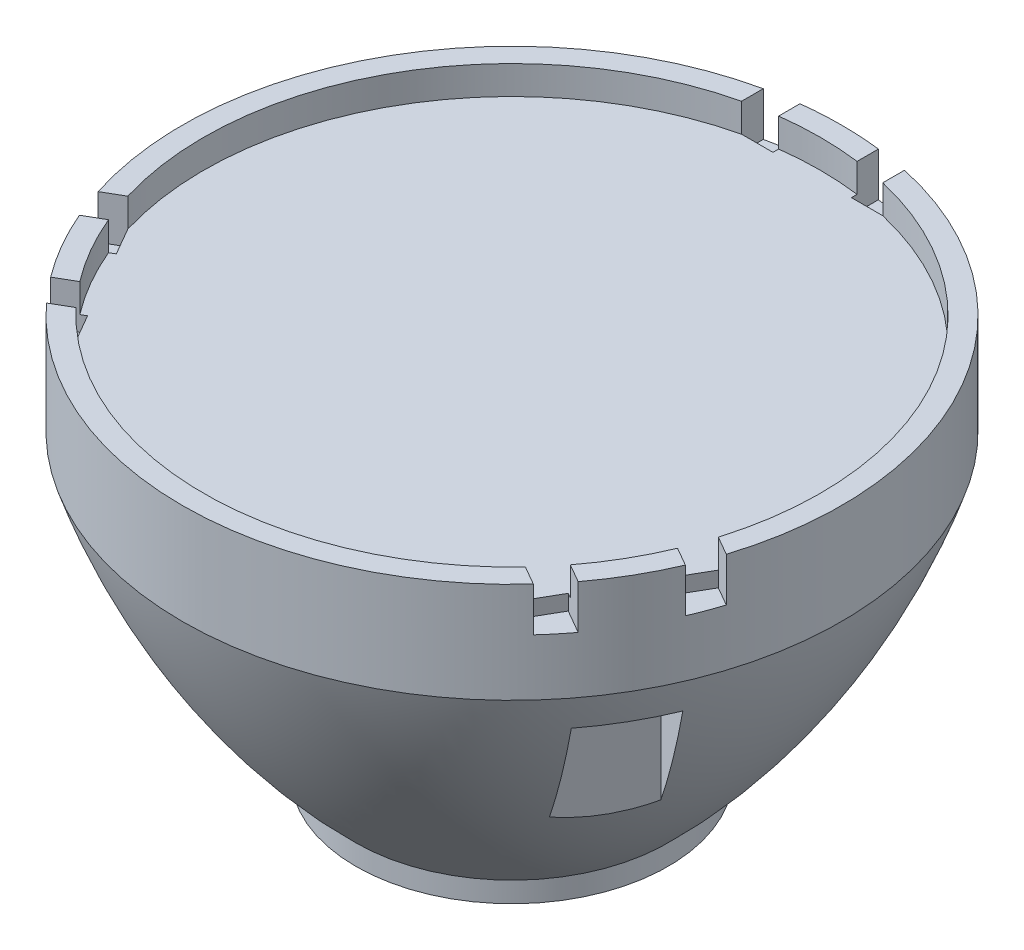
from build123d import *

# Parameters (mm, degrees)
SKETCH3_R                    = 9.825
LENS_TOP_CUT_EXTRUDE2_DEPTH  = 0.91
SKETCH2_W                    = 1
SKETCH2_H                    = 0.861432774
TOP_CUT_EXTRUDE3_DEPTH       = 1.4
BOTTOM_CUT_EXTRUDE4_DEPTH    = 0.8
SIDE_CUT_EXTRUDE5_DEPTH      = 8
SKETCH6_R                    = 2.6
LENS_HOLE_CUT_EXTRUDE7_DEPTH = 5


with BuildPart() as part:
    # Sketch1 → Lens Holder (revolve)
    with BuildSketch(Plane.XY):
        with BuildLine():
            Line((0, 0), (4.975, 0))
            Line((4.975, 0), (4.975, 0.65))
            ThreePointArc((4.975, 0.65), (8.271800133, 4.752191856), (10.5, 9.52))
            Line((10.5, 9.52), (10.5, 12.72))
            Line((10.5, 12.72), (0, 12.72))
            Line((0, 12.72), (0, 0))
        make_face()
    revolve(axis=Axis((0, 0, 0), (0, 1, 0)))

    # Sketch3 → Lens Top Cut-Extrude2 (cut)
    with BuildSketch(Plane(origin=(0, 12.72, 0), x_dir=(1, 0, 0), z_dir=(0, 1, 0))):
        Circle(SKETCH3_R)
    extrude(amount=-LENS_TOP_CUT_EXTRUDE2_DEPTH, mode=Mode.SUBTRACT)

    # Sketch2 → Top Cut-Extrude3 (cut)
    with BuildSketch(Plane(origin=(0, 12.72, 0), x_dir=(1, 0, 0), z_dir=(0, 1, 0))):
        Polygon((8.40360039, -6.29519662), (7.90360039, -7.161222024), (7.157577724, -6.730505637), (7.657577724, -5.864480233), align=None)
        with Locations((1.75, 9.994613344)):
            Rectangle(SKETCH2_W, SKETCH2_H)
        with Locations((-1.75, 9.994613344)):
            Rectangle(SKETCH2_W, SKETCH2_H)
        Polygon((10.15360039, -3.264107707), (9.65360039, -4.130133111), (8.907577724, -3.699416724), (9.407577724, -2.83339132), align=None)
        Polygon((-9.65360039, -4.130133111), (-10.15360039, -3.264107707), (-9.407577724, -2.83339132), (-8.907577724, -3.699416724), align=None)
        Polygon((-7.90360039, -7.161222024), (-8.40360039, -6.29519662), (-7.657577724, -5.864480233), (-7.157577724, -6.730505637), align=None)
    extrude(amount=-TOP_CUT_EXTRUDE3_DEPTH, mode=Mode.SUBTRACT)

    # Sketch4 → Bottom Cut-Extrude4 (cut)
    with BuildSketch(Plane.XZ):
        Polygon((2.49, 1.8), (1.99, 1.3), (2.49, 0.8), (2.49, -0.8), (1.99, -1.3), (2.49, -1.8), (2.49, -2.49), (1.8, -2.49), (1.3, -1.99), (0.8, -2.49), (-0.8, -2.49), (-1.3, -1.99), (-1.8, -2.49), (-2.49, -2.49), (-2.49, -1.8), (-1.99, -1.3), (-2.49, -0.8), (-2.49, 0.8), (-1.99, 1.3), (-2.49, 1.8), (-2.49, 2.49), (-1.8, 2.49), (-1.3, 1.99), (-0.8, 2.49), (0.8, 2.49), (1.3, 1.99), (1.8, 2.49), (2.49, 2.49), align=None)
    extrude(amount=-BOTTOM_CUT_EXTRUDE4_DEPTH, mode=Mode.SUBTRACT)

    # Sketch5 → Side Cut-Extrude5 (cut)
    with BuildSketch(Plane(origin=(0, 9.52, 0), x_dir=(1, 0, 0), z_dir=(0, 1, 0))):
        with BuildLine():
            Line((-1.3, 10.01598722), (-1.3, 8.1))
            Line((-1.3, 8.1), (1.3, 8.1))
            Line((1.3, 8.1), (1.3, 10.01598722))
            ThreePointArc((1.3, 10.01598722), (0, 10.1), (-1.3, 10.01598722))
        make_face()
        with BuildLine():
            Line((8.024099377, -6.133826635), (6.364805771, -5.175833025))
            Line((6.364805771, -5.175833025), (7.664805771, -2.924166975))
            Line((7.664805771, -2.924166975), (9.324099377, -3.882160585))
            ThreePointArc((9.324099377, -3.882160585), (8.746856578, -5.05), (8.024099377, -6.133826635))
        make_face()
        with BuildLine():
            Line((-9.324099377, -3.882160585), (-7.664805771, -2.924166975))
            Line((-7.664805771, -2.924166975), (-6.364805771, -5.175833025))
            Line((-6.364805771, -5.175833025), (-8.024099377, -6.133826635))
            ThreePointArc((-8.024099377, -6.133826635), (-8.746856578, -5.05), (-9.324099377, -3.882160585))
        make_face()
    extrude(amount=-SIDE_CUT_EXTRUDE5_DEPTH, mode=Mode.SUBTRACT)

    # Sketch6 → Lens Hole Cut-Extrude7 (cut)
    with BuildSketch(Plane.XZ.offset(-0.8)):
        Circle(SKETCH6_R)
    extrude(amount=-LENS_HOLE_CUT_EXTRUDE7_DEPTH, mode=Mode.SUBTRACT)


solid = part.part
